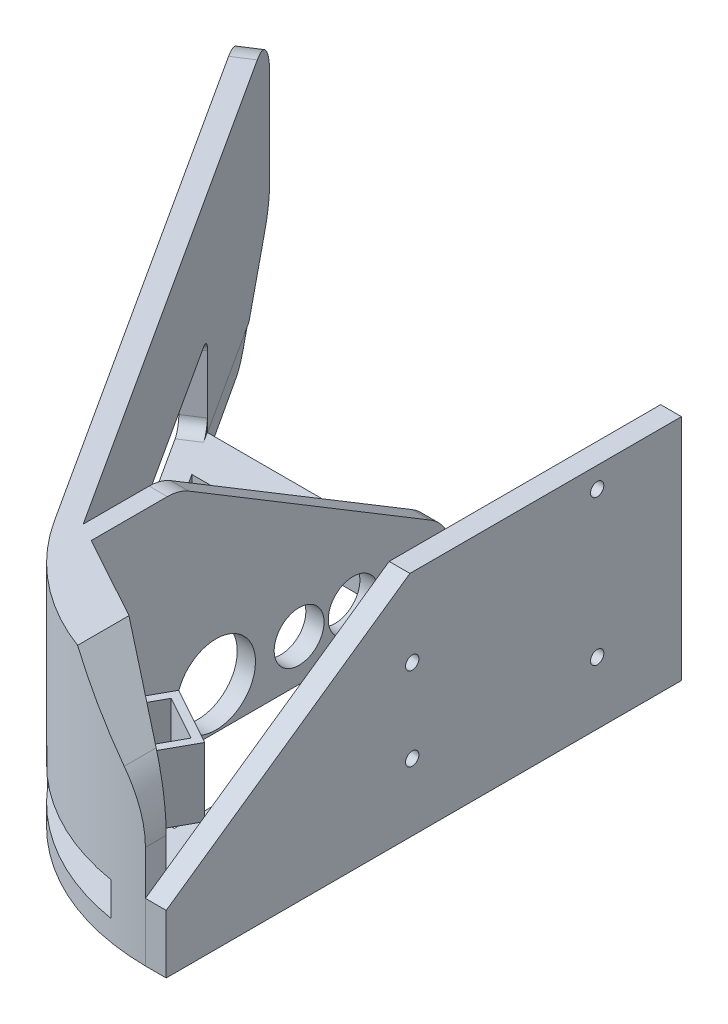
from build123d import *

# Parameters (mm, degrees)
SKETCH1_W            = 155
SKETCH1_H            = 5
BOSS_EXTRUDE2_DEPTH  = 55
SKETCH2_W            = 112
SKETCH2_H            = 45
SKETCH2_R            = 1.75
CUT_EXTRUDE1_DEPTH   = 55
SKETCH3_W            = 100
SKETCH3_H            = 20
CUT_EXTRUDE2_DEPTH   = 55
SKETCH4_W            = 40
SKETCH4_H            = 8.065867699
CUT_EXTRUDE3_DEPTH   = 55
BOSS_EXTRUDE4_DEPTH  = 5
CUT_EXTRUDE4_DEPTH   = 50
SKETCH9_W            = 4.377781836
SKETCH9_H            = 86.488706471
BOSS_EXTRUDE7_DEPTH  = 50
SKETCH10_W           = 20
SKETCH10_H           = 86.532324722
CUT_EXTRUDE5_DEPTH   = 10
SKETCH12_R           = 9.5
SKETCH12_R_2         = 6
CUT_EXTRUDE6_DEPTH   = 10
CUT_EXTRUDE7_START   = 50
SKETCH13_R           = 9.5
SKETCH13_R_2         = 6
CUT_EXTRUDE7_DEPTH   = 50
CUT_EXTRUDE8_DEPTH   = 50
CUT_EXTRUDE9_DEPTH   = 50
CUT_EXTRUDE10_DEPTH  = 10
FILLET5_R            = 3
SKETCH18_W           = 98.767816147
SKETCH18_H           = 10.604205858
BOSS_EXTRUDE8_DEPTH  = 5
CUT_EXTRUDE11_DEPTH  = 5
SKETCH20_W           = 155
SKETCH20_H           = 119
BOSS_EXTRUDE9_DEPTH  = 10
CUT_EXTRUDE13_DEPTH  = 155
SKETCH24_W           = 125
SKETCH24_H           = 8
BOSS_EXTRUDE10_DEPTH = 95
FILLET6_R            = 20
SKETCH26_W           = 16
SKETCH26_H           = 1.5
BOSS_EXTRUDE11_DEPTH = 12
BOSS_EXTRUDE12_DEPTH = 15
SKETCH28_R           = 2.5
CUT_EXTRUDE15_DEPTH  = 5
CUT_EXTRUDE17_DEPTH  = 35
SKETCH29_W           = 43
SKETCH29_H           = 43
CUT_EXTRUDE18_DEPTH  = 35
FILLET9_R            = 10
SKETCH31_W           = 124
SKETCH31_H           = 12
BOSS_EXTRUDE14_DEPTH = 2
SKETCH32_W           = 5
SKETCH32_H           = 2
BOSS_EXTRUDE15_DEPTH = 132
SKETCH33_W           = 20
SKETCH33_H           = 12
CUT_EXTRUDE19_DEPTH  = 160
SKETCH34_W           = 2
SKETCH34_H           = 12
BOSS_EXTRUDE17_DEPTH = 123
SKETCH36_R           = 6
CUT_EXTRUDE20_DEPTH  = 40
CUT_EXTRUDE21_DEPTH  = 25
SKETCH39_W           = 10
SKETCH39_H           = 12
CUT_EXTRUDE22_DEPTH  = 165
SKETCH40_W           = 2
SKETCH40_H           = 12
BOSS_EXTRUDE18_DEPTH = 115
BOSS_EXTRUDE20_REACH = 223.912
SKETCH42_W           = 5
SKETCH42_H           = 124
SKETCH45_R           = 1.6
CUT_EXTRUDE23_DEPTH  = 30
BOSS_EXTRUDE22_DEPTH = 120
SKETCH52_W           = 2
SKETCH52_H           = 14.095569493
BOSS_EXTRUDE23_DEPTH = 120
CUT_EXTRUDE26_DEPTH  = 5
FILLET14_R           = 10
FILLET15_R           = 5
FILLET16_R           = 5
FILLET17_R           = 5
FILLET18_R           = 1
SKETCH55_W           = 143.69990308
SKETCH55_H           = 184.016268103
CUT_EXTRUDE27_DEPTH  = 224.986052647
CHAMFER2_SIZE        = 20
CHAMFER2_SIZE2       = 22.212250297
FILLET19_R           = 21
SKETCH58_W           = 176.64337682
SKETCH58_H           = 51.948423731
CUT_EXTRUDE30_DEPTH  = 30


with BuildPart() as part:
    # Sketch1 → Boss-Extrude2 (new body)
    with BuildSketch(Plane(origin=(0, 0, 0), x_dir=(1, 0, 0), z_dir=(0, 1, 0))):
        Polygon((-44.578450817, 29.59757322), (-48.782107146, 26.890310125), (-130, 153), (-125.796343671, 155.707263095), align=None)
        with BuildLine():
            ThreePointArc((0, 0), (-27.802696096, 7.256044178), (-48.782107146, 26.890310125))
            Line((-48.782107146, 26.890310125), (-44.578450817, 29.59757322))
            Line((-44.578450817, 29.59757322), (0, 5))
            Line((0, 5), (0, 0))
        make_face()
        with Locations((77.5, 2.5)):
            Rectangle(SKETCH1_W, SKETCH1_H)
    extrude(amount=BOSS_EXTRUDE2_DEPTH)

    # Sketch2 → Cut-Extrude1 (cut)
    with BuildSketch(Plane.XY):
        with Locations((99, 32.5)):
            Rectangle(SKETCH2_W, SKETCH2_H)
        with Locations((5, 25)):
            Circle(SKETCH2_R)
        with Locations((5, 50)):
            Circle(SKETCH2_R)
        with Locations((35, 50)):
            Circle(SKETCH2_R)
        with Locations((35, 25)):
            Circle(SKETCH2_R)
    extrude(amount=-CUT_EXTRUDE1_DEPTH, mode=Mode.SUBTRACT)

    # Sketch3 → Cut-Extrude2 (cut)
    with BuildSketch(Plane(origin=(-22.239707671, 0, 14.322945338), x_dir=(0.5414526190246729, 0, 0.840731265834287), z_dir=(-0.8407312658342869, 0, 0.5414526190246728))):
        with Locations((-99.020724146, 15)):
            Rectangle(SKETCH3_W, SKETCH3_H)
    extrude(amount=-CUT_EXTRUDE2_DEPTH, mode=Mode.SUBTRACT)

    # Sketch4 → Cut-Extrude3 (cut)
    with BuildSketch(Plane(origin=(2.114976352, 0, -3.832994761), x_dir=(-0.8755563671808256, 0, -0.48311597767939257), z_dir=(0.48311597767939257, 0, -0.8755563671808256))):
        with Locations((28.330006975, 9.03293385)):
            Rectangle(SKETCH4_W, SKETCH4_H)
    extrude(amount=-CUT_EXTRUDE3_DEPTH, mode=Mode.SUBTRACT)

    # Sketch5 → Boss-Extrude4 (add)
    with BuildSketch(Plane.XZ):
        Polygon((0, -5), (-44.578450817, -29.59757322), (-125.796343671, -155.707263095), (0, -155.707263095), align=None)
    extrude(amount=-BOSS_EXTRUDE4_DEPTH)

    # Sketch8 → Cut-Extrude4 (cut)
    with BuildSketch(Plane(origin=(0, 5, 0), x_dir=(1, 0, 0), z_dir=(0, 1, 0))):
        Polygon((-44.578450817, 29.59757322), (-98.72371272, 113.670699803), (-44.578450817, 113.670699803), align=None)
    extrude(amount=-CUT_EXTRUDE4_DEPTH, mode=Mode.SUBTRACT)

    # Sketch9 → Boss-Extrude7 (add)
    with BuildSketch(Plane(origin=(0, 5, 0), x_dir=(1, 0, 0), z_dir=(0, 1, 0))):
        with Locations((-42.389559899, 70.426346568)):
            Rectangle(SKETCH9_W, SKETCH9_H)
    extrude(amount=BOSS_EXTRUDE7_DEPTH)

    # Sketch10 → Cut-Extrude5 (cut)
    with BuildSketch(Plane(origin=(0, 5, 0), x_dir=(1, 0, 0), z_dir=(0, 1, 0))):
        with Locations((-30.200668981, 70.404537442)):
            Rectangle(SKETCH10_W, SKETCH10_H)
    extrude(amount=-CUT_EXTRUDE5_DEPTH, mode=Mode.SUBTRACT)

    # Sketch12 → Cut-Extrude6 (cut)
    with BuildSketch(Plane(origin=(-40.200668981, 0, 0), x_dir=(0, 0, -1), z_dir=(1, 0, 0))):
        with Locations(Location((57.181993332, 10, 0), (0, 0, 90))):
            Circle(SKETCH12_R)
        with Locations(Location((77.181993332, 10, 0), (0, 0, 90))):
            Circle(SKETCH12_R_2)
    extrude(amount=-CUT_EXTRUDE6_DEPTH, mode=Mode.SUBTRACT)

    # Sketch13 → Cut-Extrude7 (cut)
    with BuildSketch(Plane(origin=(-40.200668981, 0, 0), x_dir=(0, 0, -1), z_dir=(1, 0, 0)).offset(CUT_EXTRUDE7_START)):
        with Locations(Location((57.181993332, 10, 0), (0, 0, 90))):
            Circle(SKETCH13_R)
        with Locations(Location((77.181993332, 10, 0), (0, 0, 90))):
            Circle(SKETCH13_R_2)
    extrude(amount=-CUT_EXTRUDE7_DEPTH, mode=Mode.SUBTRACT)

    # Sketch14 → Cut-Extrude8 (cut)
    with BuildSketch(Plane(origin=(0, 5, 0), x_dir=(1, 0, 0), z_dir=(0, 1, 0))):
        Polygon((0, 103.038090201), (-91.876037903, 103.038090201), (-126.106254173, 155.707263095), (0, 155.707263095), align=None)
    extrude(amount=-CUT_EXTRUDE8_DEPTH, mode=Mode.SUBTRACT)

    # Sketch15 → Cut-Extrude9 (cut)
    with BuildSketch(Plane(origin=(-22.239707671, 0, 14.322945338), x_dir=(0.5414526190246729, 0, 0.840731265834287), z_dir=(-0.8407312658342869, 0, 0.5414526190246728))):
        Polygon((-176.035909688, 0), (-199.020724146, 18.247450711), (-199.020724146, 0), align=None)
    extrude(amount=-CUT_EXTRUDE9_DEPTH, mode=Mode.SUBTRACT)

    # Sketch16 → Cut-Extrude10 (cut)
    with BuildSketch(Plane(origin=(-40.200668981, 0, 0), x_dir=(0, 0, -1), z_dir=(1, 0, 0))):
        Polygon((113.670699803, 15.495236251), (48.252901996, 55), (113.670699803, 55), align=None)
    extrude(amount=-CUT_EXTRUDE10_DEPTH, mode=Mode.SUBTRACT)

    # Fillet5
    fillet5_edges = [part.edges().sort_by_distance(p)[0] for p in [
        (-100.847592598, 5, -112.302866383),
        (-46.680278982, 25, -28.243941672),
        (-46.680278982, 5, -28.243941672),
        (-100.825540884, 25, -112.317068256),
    ]]
    fillet(fillet5_edges, radius=FILLET5_R)

    # Sketch18 → Boss-Extrude8 (add)
    with BuildSketch(Plane(origin=(0, 5, 0), x_dir=(1, 0, 0), z_dir=(0, 1, 0))):
        with Locations((-49.383908074, 108.34019313)):
            Rectangle(SKETCH18_W, SKETCH18_H)
    extrude(amount=-BOSS_EXTRUDE8_DEPTH)

    # Sketch19 → Cut-Extrude11 (cut)
    with BuildSketch(Plane.XZ):
        Polygon((-97.82324149, -103.038090201), (-98.767816147, -104.504762295), (-98.767816147, -103.038090201), align=None)
    extrude(amount=-CUT_EXTRUDE11_DEPTH, mode=Mode.SUBTRACT)

    # Sketch20 → Boss-Extrude9 (add)
    with BuildSketch(Plane.XZ):
        with Locations((77.5, -64.5)):
            Rectangle(SKETCH20_W, SKETCH20_H)
    extrude(amount=-BOSS_EXTRUDE9_DEPTH)

    # Sketch21 → Cut-Extrude13 (cut)
    with BuildSketch(Plane(origin=(155, 0, 0), x_dir=(0, 0, -1), z_dir=(1, 0, 0))):
        Polygon((5, 10), (124, 10), (124, 7), align=None)
    extrude(amount=-CUT_EXTRUDE13_DEPTH, mode=Mode.SUBTRACT)

    # Sketch24 → Boss-Extrude10 (add)
    with BuildSketch(Plane.XZ):
        with Locations((62.5, -120)):
            Rectangle(SKETCH24_W, SKETCH24_H)
    extrude(amount=-BOSS_EXTRUDE10_DEPTH)

    # Fillet6
    fillet6_edges = [part.edges().sort_by_distance(p)[0] for p in [
        (62.5, 7.201680672, -116),
    ]]
    fillet(fillet6_edges, radius=FILLET6_R)

    # Sketch26 → Boss-Extrude11 (add)
    with BuildSketch(Plane(origin=(2.114976352, 0, -3.832994761), x_dir=(-0.8755563671808256, 0, -0.48311597767939257), z_dir=(0.48311597767939257, 0, -0.8755563671808256))):
        with Locations((28.330006975, 13.815867699)):
            Rectangle(SKETCH26_W, SKETCH26_H)
    extrude(amount=BOSS_EXTRUDE11_DEPTH)

    # Sketch27 → Boss-Extrude12 (add)
    with BuildSketch(Plane(origin=(0, 14.565867699, 0), x_dir=(1, 0, 0), z_dir=(0, 1, 0))):
        Polygon((-15.6850907, 13.654745957), (-9.887698968, 24.161422363), (-23.896600843, 31.891278006), (-29.693992575, 21.384601599), (-28.030435477, 20.466681242), (-23.150964103, 29.30980055), (-12.469176423, 23.415785623), (-17.348647798, 14.572666314), align=None)
    extrude(amount=BOSS_EXTRUDE12_DEPTH)

    # Sketch28 → Cut-Extrude15 (cut)
    with BuildSketch(Plane(origin=(0, 14.565867699, 0), x_dir=(1, 0, 0), z_dir=(0, 1, 0))):
        with Locations(Location((-20.24980595, 21.941233432, 0), (0, 0, 180))):
            Circle(SKETCH28_R)
    extrude(amount=-CUT_EXTRUDE15_DEPTH, mode=Mode.SUBTRACT)

    # Sketch25 → Cut-Extrude17 (cut)
    with BuildSketch(Plane(origin=(0, 0, -124), x_dir=(-1, 0, 0), z_dir=(0, 0, -1))):
        with BuildLine():
            Line((-36.75, 77), (-36.75, 72))
            ThreePointArc((-36.75, 72), (-35, 70.25), (-33.25, 72))
            Line((-33.25, 72), (-33.25, 77))
            ThreePointArc((-33.25, 77), (-35, 78.75), (-36.75, 77))
        make_face()
        with BuildLine():
            Line((-73.25, 77), (-73.25, 72))
            ThreePointArc((-73.25, 72), (-75, 70.25), (-76.75, 72))
            Line((-76.75, 72), (-76.75, 77))
            ThreePointArc((-76.75, 77), (-75, 78.75), (-73.25, 77))
        make_face()
    extrude(amount=-CUT_EXTRUDE17_DEPTH, mode=Mode.SUBTRACT)

    # Sketch29 → Cut-Extrude18 (cut)
    with BuildSketch(Plane.XY):
        with Locations((21.5, 33.5)):
            Rectangle(SKETCH29_W, SKETCH29_H)
    extrude(amount=-CUT_EXTRUDE18_DEPTH, mode=Mode.SUBTRACT)

    # Fillet9
    fillet9_edges = [part.edges().sort_by_distance(p)[0] for p in [
        (-115.522140631, 0, -134.985040643),
        (-127.898171835, 18.247450711, -154.353631548),
        (-42.389559899, 15.495236251, -113.670699803),
        (-42.389559899, 55, -48.252901996),
        (-127.898171835, 55, -154.353631548),
    ]]
    fillet(fillet9_edges, radius=FILLET9_R)

    # Sketch31 → Boss-Extrude14 (add)
    with BuildSketch(Plane(origin=(155, 0, 0), x_dir=(0, 0, -1), z_dir=(1, 0, 0))):
        with Locations((62, 6)):
            Rectangle(SKETCH31_W, SKETCH31_H)
    extrude(amount=-BOSS_EXTRUDE14_DEPTH)

    # Sketch32 → Boss-Extrude15 (add)
    with BuildSketch(Plane.ZY.offset(-153)):
        with Locations((-2.5, 11)):
            Rectangle(SKETCH32_W, SKETCH32_H)
    extrude(amount=BOSS_EXTRUDE15_DEPTH)

    # Sketch33 → Cut-Extrude19 (cut)
    with BuildSketch(Plane.XY):
        with Locations((145, 6)):
            Rectangle(SKETCH33_W, SKETCH33_H)
    extrude(amount=-CUT_EXTRUDE19_DEPTH, mode=Mode.SUBTRACT)

    # Sketch34 → Boss-Extrude17 (add)
    with BuildSketch(Plane.XY):
        with Locations((134, 6)):
            Rectangle(SKETCH34_W, SKETCH34_H)
    extrude(amount=-BOSS_EXTRUDE17_DEPTH)

    # Sketch36 → Cut-Extrude20 (cut, symmetric)
    with BuildSketch(Plane(origin=(-40.200668981, 0, 0), x_dir=(0, 0, -1), z_dir=(1, 0, 0))):
        with Locations(Location((90.194878088, 10, 0), (0, 0, 90))):
            Circle(SKETCH36_R)
    extrude(amount=CUT_EXTRUDE20_DEPTH, both=True, mode=Mode.SUBTRACT)

    # Sketch38 → Cut-Extrude21 (cut)
    with BuildSketch(Plane(origin=(125, 0, 0), x_dir=(0, 0, -1), z_dir=(1, 0, 0))):
        Polygon((95.495958465, 7.718589282), (124, 7), (124, 95), (116, 95), align=None)
    extrude(amount=-CUT_EXTRUDE21_DEPTH, mode=Mode.SUBTRACT)

    # Sketch39 → Cut-Extrude22 (cut)
    with BuildSketch(Plane.XY):
        with Locations((130, 6)):
            Rectangle(SKETCH39_W, SKETCH39_H)
    extrude(amount=-CUT_EXTRUDE22_DEPTH, mode=Mode.SUBTRACT)

    # Sketch40 → Boss-Extrude18 (add)
    with BuildSketch(Plane.XY):
        with Locations((124, 6)):
            Rectangle(SKETCH40_W, SKETCH40_H)
    extrude(amount=-BOSS_EXTRUDE18_DEPTH)

    # Boss-Extrude20: up to this face of the body (flat: up to its plane)
    boss_extrude20_end = Plane(part.part.faces().sort_by_distance((50, 95, -120))[0])
    # Sketch42 → Boss-Extrude20 (add, up to the picked face)
    with BuildSketch(Plane(origin=(0, 5, 0), x_dir=(1, 0, 0), z_dir=(0, 1, 0)), mode=Mode.PRIVATE) as boss_extrude20_sk1:
        with Locations((2.5, 62)):
            Rectangle(SKETCH42_W, SKETCH42_H)
    boss_extrude20_tool1 = split(extrude(boss_extrude20_sk1.sketch, amount=BOSS_EXTRUDE20_REACH, mode=Mode.PRIVATE), bisect_by=boss_extrude20_end, keep=Keep.BOTH, mode=Mode.PRIVATE)
    add(boss_extrude20_tool1.solids().sort_by(Axis((2.5, 5, -62), (0, 1, 0)))[0])

    # Sketch45 → Cut-Extrude23 (cut)
    with BuildSketch(Plane(origin=(5, 0, 0), x_dir=(0, 0, -1), z_dir=(1, 0, 0))):
        with Locations(Location((59.208509529, 36.135781847, 0), (0, 0, 90))):
            Circle(SKETCH45_R)
        with Locations(Location((59.208509529, 16.135781847, 0), (0, 0, 90))):
            Circle(SKETCH45_R)
        with Locations(Location((103.718271361, 50.013687011, 0), (0, 0, 90))):
            Circle(SKETCH45_R)
        with Locations(Location((103.718271361, 15.013687011, 0), (0, 0, 90))):
            Circle(SKETCH45_R)
    extrude(amount=-CUT_EXTRUDE23_DEPTH, mode=Mode.SUBTRACT)

    # Sketch51 → Boss-Extrude22 (add)
    with BuildSketch(Plane(origin=(125, 0, 0), x_dir=(0, 0, -1), z_dir=(1, 0, 0))):
        Polygon((124, 7), (5, 12), (5, 14.095569493), (0, 14.095569493), (0, 7.113445378), align=None)
    extrude(amount=-BOSS_EXTRUDE22_DEPTH)

    # Sketch52 → Boss-Extrude23 (add)
    with BuildSketch(Plane.XY):
        with Locations((124, 7.047784747)):
            Rectangle(SKETCH52_W, SKETCH52_H)
    extrude(amount=-BOSS_EXTRUDE23_DEPTH)

    # Sketch54 → Cut-Extrude26 (cut)
    with BuildSketch(Plane(origin=(5, 0, 0), x_dir=(0, 0, -1), z_dir=(1, 0, 0))):
        Polygon((0, 14.095569493), (116, 95), (0, 95), align=None)
    extrude(amount=-CUT_EXTRUDE26_DEPTH, mode=Mode.SUBTRACT)

    # Fillet14
    fillet14_edges = [part.edges().sort_by_distance(p)[0] for p in [
        (100, 7.513892889, -111.769349239),
    ]]
    fillet(fillet14_edges, radius=FILLET14_R)

    # Fillet15
    fillet15_edges = [part.edges().sort_by_distance(p)[0] for p in [
        (124, 14.095569493, -120),
    ]]
    fillet(fillet15_edges, radius=FILLET15_R)

    # Fillet16
    # the kernel refuses this fillet: 5 mm, written as the material it adds along each edge
    with BuildSketch(Plane(origin=(123, 7.168067227, -120), x_dir=(0, 0.9980473315851939, 0.062462179882501946), z_dir=(1, 0, 0))) as fillet16_piece_1:
        with BuildLine():
            CenterArc((4.502899102, -4.869840665), FILLET16_R, 103.101980319, 66.66628485)
            Line((-0.417587767, -3.981691481), (-0.909636454, -3.892876563))
            ThreePointArc((-0.909636454, -3.892876563), (-0.706066567, -1.938693285), (-0.497272683, 0.052152456))
            Line((-0.497272683, 0.052152456), (0.03123109, 0.499023666))
            ThreePointArc((0.03123109, 0.499023666), (1.954969583, 0.378627673), (3.256131762, 0.486984066))
            Line((3.256131762, 0.486984066), (3.369474248, 0))
        make_face()
    extrude(amount=2)

    # Fillet17
    fillet17_edges = [part.edges().sort_by_distance(p)[0] for p in [
        (100, 95, -120),
    ]]
    fillet(fillet17_edges, radius=FILLET17_R)

    # Fillet18
    fillet18_edges = [part.edges().sort_by_distance(p)[0] for p in [
        (5, 10.013892889, -52.269349239),
    ]]
    fillet(fillet18_edges, radius=FILLET18_R)

    # Sketch55 → Cut-Extrude27 (cut, through all)
    with BuildSketch(Plane.XY):
        with Locations((76.84995154, 92.008134052)):
            Rectangle(SKETCH55_W, SKETCH55_H)
    extrude(amount=-CUT_EXTRUDE27_DEPTH, mode=Mode.SUBTRACT)

    # Chamfer2
    chamfer2_edges = [part.edges().sort_by_distance(p)[0] for p in [
        (0, 55, -2.5),
    ]]
    chamfer2_side = [part.faces().sort_by_distance(p)[0] for p in [
        (-42.129886846, 55, -36.324850438),
    ]]
    chamfer(chamfer2_edges, length=CHAMFER2_SIZE, length2=CHAMFER2_SIZE2, reference=chamfer2_side[0])

    # Fillet19
    fillet19_edges = [part.edges().sort_by_distance(p)[0] for p in [
        (0, 32.787749703, -2.5),
    ]]
    fillet(fillet19_edges, radius=FILLET19_R)

    # Sketch58 → Cut-Extrude30 (cut)
    with BuildSketch(Plane(origin=(5, 0, 0), x_dir=(0, 0, -1), z_dir=(1, 0, 0))):
        with Locations((62.367890206, 80.974211865)):
            Rectangle(SKETCH58_W, SKETCH58_H)
    extrude(amount=-CUT_EXTRUDE30_DEPTH, mode=Mode.SUBTRACT)


solid = part.part
